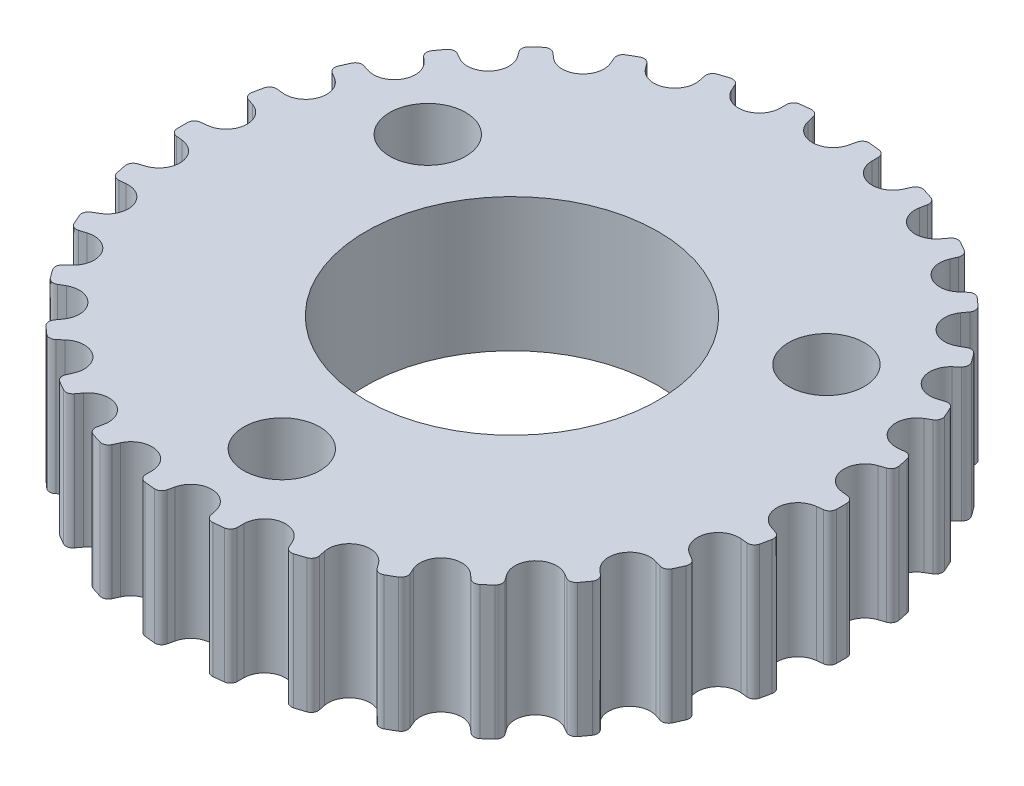
from build123d import *

# Parameters (mm, degrees)
SKETCH1_R           = 14.323944878
BOSS_EXTRUDE1_DEPTH = 5.8
CUT_EXTRUDE1_DEPTH  = 22.07108905
CIRPATTERN1_COUNT   = 30
SKETCH3_R           = 6.35
CUT_EXTRUDE2_DEPTH  = 22.033616305
SKETCH4_R           = 1.65
CUT_EXTRUDE3_DEPTH  = 22.033616305


with BuildPart() as part:
    # Sketch1 → Boss-Extrude1 (new body)
    with BuildSketch(Plane(origin=(0, 0, 0), x_dir=(1, 0, 0), z_dir=(0, 1, 0))):
        Circle(SKETCH1_R)
    extrude(amount=BOSS_EXTRUDE1_DEPTH)

    # Sketch2 → Cut-Extrude1 (cut, through all)
    with BuildSketch(Plane(origin=(0, 5.8, 0), x_dir=(1, 0, 0), z_dir=(0, 1, 0))):
        with BuildLine():
            Line((-0.88830444, 13.756422166), (-0.95, 14.033881093))
            ThreePointArc((-0.95, 14.033881093), (-1.065709647, 14.210883809), (-1.269434594, 14.267583281))
            ThreePointArc((-1.269434594, 14.267583281), (-2.127648488, 14.165045315), (-2.978115599, 14.010932316))
            Line((-2.978115599, 14.010932316), (-2.978115599, 14.323944878))
            Line((-2.978115599, 14.323944878), (2.978115599, 14.323944878))
            Line((2.978115599, 14.323944878), (2.978115599, 14.010932316))
            ThreePointArc((2.978115599, 14.010932316), (2.127648488, 14.165045315), (1.269434594, 14.267583281))
            ThreePointArc((1.269434594, 14.267583281), (1.065709647, 14.210883809), (0.95, 14.033881093))
            Line((0.95, 14.033881093), (0.88830444, 13.756422166))
            ThreePointArc((0.88830444, 13.756422166), (0, 13.043944878), (-0.88830444, 13.756422166))
        make_face()
    cut_extrude1 = extrude(amount=-CUT_EXTRUDE1_DEPTH, mode=Mode.SUBTRACT)

    # CirPattern1: Cut-Extrude1 ×30 about axis
    cirpattern1_axis = Axis((0, 5.8, 0), (0, -1, 0))
    for i in range(1, CIRPATTERN1_COUNT):
        add(cut_extrude1.rotate(cirpattern1_axis, i * 360 / CIRPATTERN1_COUNT), mode=Mode.SUBTRACT)

    # Sketch3 → Cut-Extrude2 (cut, through all)
    with BuildSketch(Plane.XZ):
        Circle(SKETCH3_R)
    extrude(amount=-CUT_EXTRUDE2_DEPTH, mode=Mode.SUBTRACT)

    # Sketch4 → Cut-Extrude3 (cut, through all)
    with BuildSketch(Plane.XZ):
        with Locations((0, 10)):
            Circle(SKETCH4_R)
        with Locations((8.660254038, -5)):
            Circle(SKETCH4_R)
        with Locations((-8.660254038, -5)):
            Circle(SKETCH4_R)
    extrude(amount=-CUT_EXTRUDE3_DEPTH, mode=Mode.SUBTRACT)


solid = part.part
